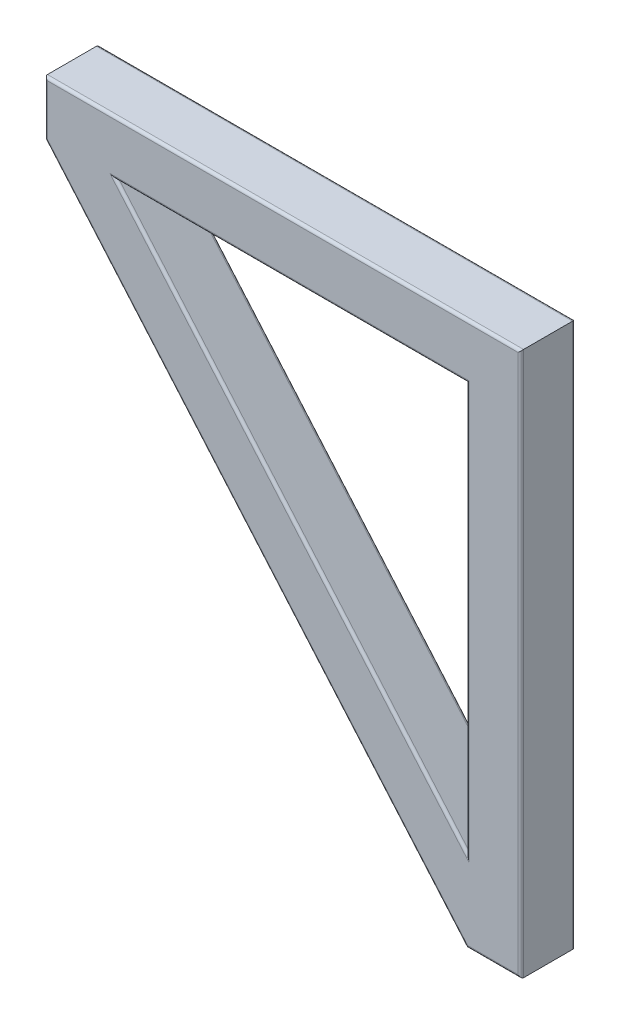
from build123d import *

# Parameters (mm, degrees)
BOSS_EXTRU_1_DEPTH = 40
CONG_1_R           = 2
COQUE1_START       = 4
COQUE1_DEPTH       = 32


# Read off the part's stored shape, not the designer's step: Coque1
with BuildPart() as part:
    # Esquisse1 → Boss.-Extru.1 (new body)
    with BuildSketch(Plane.XY):
        Polygon((0, 0), (0, 400), (-350, 400), (-350, 360), (-40, 0), align=None)
        Polygon((-297.798149171, 360), (-40, 360), (-40, 60.621504188), align=None, mode=Mode.SUBTRACT)
    extrude(amount=BOSS_EXTRU_1_DEPTH)

    # Congé1
    cong_1_edges = [part.edges().sort_by_distance(p)[0] for p in [
        (-175, 400, 40),
        (-350, 380, 40),
        (-195, 180, 40),
        (-168.899074586, 210.310752094, 0),
        (-40, 210.310752094, 0),
        (-168.899074586, 360, 0),
        (-168.899074586, 210.310752094, 40),
        (-40, 210.310752094, 40),
        (-168.899074586, 360, 40),
        (-20, 0, 40),
        (-195, 180, 0),
        (-350, 380, 0),
        (-175, 400, 0),
        (0, 200, 0),
        (-20, 0, 0),
        (0, 200, 40),
    ]]
    fillet(cong_1_edges, radius=CONG_1_R)

    # Coque1 outline → Coque1 (cut)
    with BuildSketch(Plane.XY.offset(COQUE1_START)):
        Polygon((-38.165789547, 4), (-4, 4), (-4, 396), (-346, 396), (-346, 361.484889559), align=None)
        Polygon((-36, 364), (-36, 49.846292049), (-306.521248514, 364), align=None, mode=Mode.SUBTRACT)
    extrude(amount=COQUE1_DEPTH, mode=Mode.SUBTRACT)


solid = part.part
